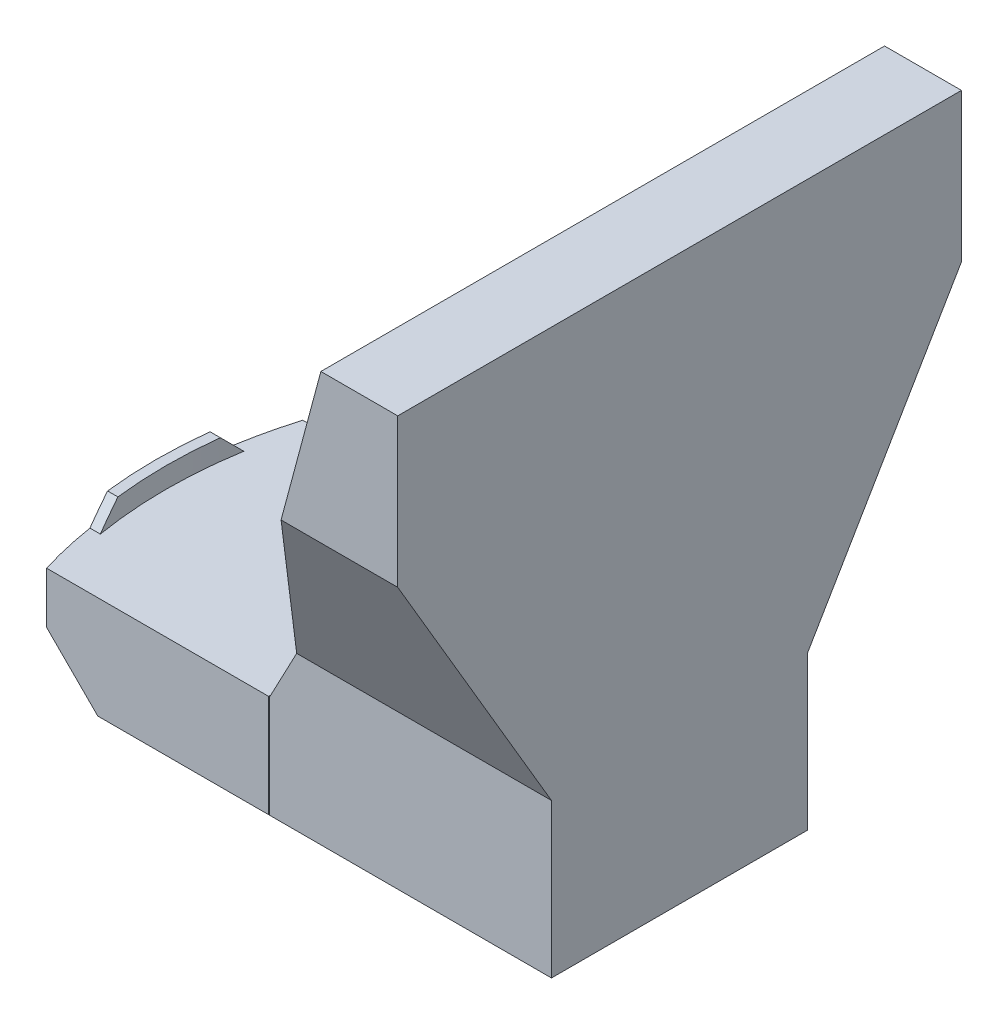
from build123d import *

# Parameters (mm, degrees)
DODANIE_WYCI_GNI_CIE1_DEPTH      = 20
WYTNIJ_WYCI_GNI_CIE1_DEPTH       = 60.019416665
DODANIE_WYCI_GNI_CIE2_DEPTH      = 4
SFAZOWANIE1_SIZE                 = 4
DODANIE_WYCI_GNI_CIE3_DEPTH      = 30
DODANIE_WYCI_GNI_CIE3_DEPTH_BACK = 80
WYTNIJ_WYCI_GNI_CIE2_DEPTH       = 160.903895728


with BuildPart() as part:
    # Szkic1 → Dodanie-wyciągnięcie1 (new body)
    with BuildSketch(Plane(origin=(0, 0, 0), x_dir=(1, 0, 0), z_dir=(0, 1, 0))):
        with BuildLine():
            Line((22.848570571, -15), (22.848570571, 25))
            Line((22.848570571, 25), (-20.482096053, 25))
            ThreePointArc((-20.482096053, 25), (-23.999572469, 5.138097937), (-22.848570571, -15))
            ThreePointArc((-22.848570571, -15), (-21.813108774, -20.034970687), (-20.482096053, -25))
            Line((-20.482096053, -25), (22.848570571, -25))
            Line((22.848570571, -25), (22.848570571, -15))
        make_face()
    extrude(amount=DODANIE_WYCI_GNI_CIE1_DEPTH)

    # Szkic2 → Wytnij-wyciągnięcie1 (cut, through all)
    with BuildSketch(Plane.XY.offset(25)):
        Polygon((-10.482096053, 0), (-25.036409358, 14.554313306), (-25.036409358, -2.735429271), (-10.482096053, -2.735429271), align=None)
    extrude(amount=-WYTNIJ_WYCI_GNI_CIE1_DEPTH, mode=Mode.SUBTRACT)

    # Szkic3 → Dodanie-wyciągnięcie2 (add)
    with BuildSketch(Plane(origin=(0, 20, 0), x_dir=(1, 0, 0), z_dir=(0, 1, 0))):
        with BuildLine():
            Line((-23.017604376, -14), (-20.990561104, -14))
            ThreePointArc((-20.990561104, -14), (-22.151429429, 0), (-20.990561104, 14))
            Line((-20.990561104, 14), (-23.017604376, 14))
            ThreePointArc((-23.017604376, 14), (-24.151429429, 0), (-23.017604376, -14))
        make_face()
    extrude(amount=DODANIE_WYCI_GNI_CIE2_DEPTH)

    # Sfazowanie1
    sfazowanie1_edges = [part.edges().sort_by_distance(p)[0] for p in [
        (-22.00408274, 24, -14),
        (-22.00408274, 24, 14),
    ]]
    chamfer(sfazowanie1_edges, length=SFAZOWANIE1_SIZE - 0.0001)  # a hair under: the kernel refuses the full size


with BuildPart() as body_2:
    # Szkic4 → Dodanie-wyciągnięcie3 (new, two sides: drawn at the far end of the back side and taken through both)
    with BuildSketch(Plane.XY.offset(25).offset(-DODANIE_WYCI_GNI_CIE3_DEPTH_BACK)):
        Polygon((63.045712747, 110), (55.281141394, 81.022225211), (23.045712747, 20), (23.045712747, 0), (63.045712747, 0), (78.045712747, 0), (78.045712747, 110), align=None)
    extrude(amount=DODANIE_WYCI_GNI_CIE3_DEPTH + DODANIE_WYCI_GNI_CIE3_DEPTH_BACK)

    # Szkic5 → Wytnij-wyciągnięcie2 (cut, through all)
    with BuildSketch(Plane(origin=(78.045712747, 0, 0), x_dir=(0, 0, -1), z_dir=(1, 0, 0))):
        Polygon((-55, 0), (-25, 0), (-25, 30), (-55, 81.022225211), align=None)
    wytnij_wyci_gni_cie2 = extrude(amount=-WYTNIJ_WYCI_GNI_CIE2_DEPTH, mode=Mode.SUBTRACT)

    # Lustro1: Wytnij-wyciągnięcie2 across plane
    add(wytnij_wyci_gni_cie2.mirror(Plane.XY), mode=Mode.SUBTRACT)


solid = Compound([part.part, body_2.part])
